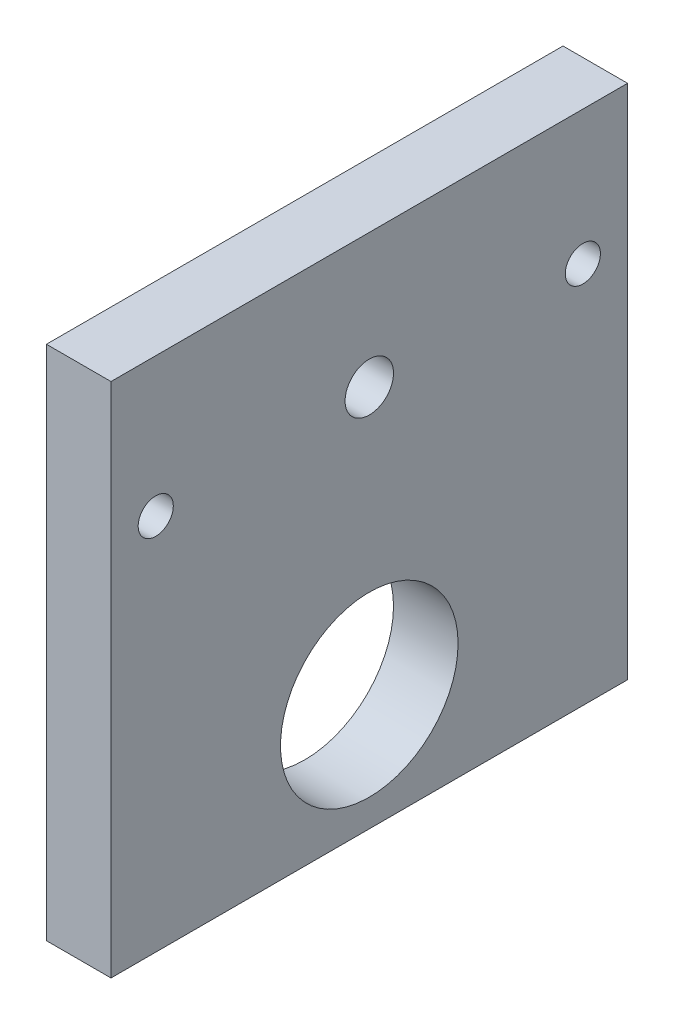
from build123d import *

# Parameters (mm, degrees)
SKETCH1_W                           = 50.8
SKETCH1_H                           = 50.8
BOSS_EXTRUDE1_DEPTH                 = 6.35
F_11_16_0_6875_DIAMETER_HOLE1_D     = 17.4625
F_11_16_0_6875_DIAMETER_HOLE1_DEPTH = 70.104
F_11_16_0_6875_DIAMETER_HOLE1_TIP   = 5.24626428
F_3_16_0_1875_DIAMETER_HOLE1_D      = 4.7625
F_3_16_0_1875_DIAMETER_HOLE1_DEPTH  = 70.104
F_3_16_0_1875_DIAMETER_HOLE1_TIP    = 1.430799349
F_29_0_136_DIAMETER_HOLE1_D         = 3.4544
F_29_0_136_DIAMETER_HOLE1_DEPTH     = 70.104
F_29_0_136_DIAMETER_HOLE1_TIP       = 1.037806461
F_10_32_TAPPED_HOLE1_D              = 4.0386
F_10_32_TAPPED_HOLE1_DEPTH          = 11.938
F_10_32_TAPPED_HOLE1_TIP            = 1.213317848


with BuildPart() as part:
    # Sketch1 → Boss-Extrude1 (new body)
    with BuildSketch(Plane(origin=(0, 0, 0), x_dir=(0, 0, -1), z_dir=(1, 0, 0))):
        Rectangle(SKETCH1_W, SKETCH1_H)
    extrude(amount=BOSS_EXTRUDE1_DEPTH)

    # 11/16 (0.6875) Diameter Hole1
    with Locations(Plane(origin=(6.35, 0, 0), x_dir=(0, 0, -1), z_dir=(1, 0, 0))):
        with Locations((0, -13.97)):
            Hole(F_11_16_0_6875_DIAMETER_HOLE1_D / 2, depth=F_11_16_0_6875_DIAMETER_HOLE1_DEPTH)
            with Locations((0, 0, -(F_11_16_0_6875_DIAMETER_HOLE1_DEPTH + F_11_16_0_6875_DIAMETER_HOLE1_TIP / 2))):  # 118° drill point
                Cone(0, F_11_16_0_6875_DIAMETER_HOLE1_D / 2, F_11_16_0_6875_DIAMETER_HOLE1_TIP, mode=Mode.SUBTRACT)

    # 3/16 (0.1875) Diameter Hole1
    with Locations(Plane(origin=(6.35, 0, 0), x_dir=(0, 0, -1), z_dir=(1, 0, 0))):
        with Locations((0, 12.2301)):
            Hole(F_3_16_0_1875_DIAMETER_HOLE1_D / 2, depth=F_3_16_0_1875_DIAMETER_HOLE1_DEPTH)
            with Locations((0, 0, -(F_3_16_0_1875_DIAMETER_HOLE1_DEPTH + F_3_16_0_1875_DIAMETER_HOLE1_TIP / 2))):  # 118° drill point
                Cone(0, F_3_16_0_1875_DIAMETER_HOLE1_D / 2, F_3_16_0_1875_DIAMETER_HOLE1_TIP, mode=Mode.SUBTRACT)

    # #29 (0.136) Diameter Hole1
    with Locations(Plane(origin=(6.35, 0, 0), x_dir=(0, 0, -1), z_dir=(1, 0, 0))):
        with Locations((21, 12.2301), (-21, 11.74145915)):
            Hole(F_29_0_136_DIAMETER_HOLE1_D / 2, depth=F_29_0_136_DIAMETER_HOLE1_DEPTH)
            with Locations((0, 0, -(F_29_0_136_DIAMETER_HOLE1_DEPTH + F_29_0_136_DIAMETER_HOLE1_TIP / 2))):  # 118° drill point
                Cone(0, F_29_0_136_DIAMETER_HOLE1_D / 2, F_29_0_136_DIAMETER_HOLE1_TIP, mode=Mode.SUBTRACT)

    # #10-32 Tapped Hole1
    with Locations(Plane(origin=(0, -25.4, 0), x_dir=(-1, 0, 0), z_dir=(0, -1, 0))):
        with Locations((-3.175, -19.05), (-3.175, 19.05)):
            Hole(F_10_32_TAPPED_HOLE1_D / 2, depth=F_10_32_TAPPED_HOLE1_DEPTH)
            with Locations((0, 0, -(F_10_32_TAPPED_HOLE1_DEPTH + F_10_32_TAPPED_HOLE1_TIP / 2))):  # 118° drill point
                Cone(0, F_10_32_TAPPED_HOLE1_D / 2, F_10_32_TAPPED_HOLE1_TIP, mode=Mode.SUBTRACT)


solid = part.part
